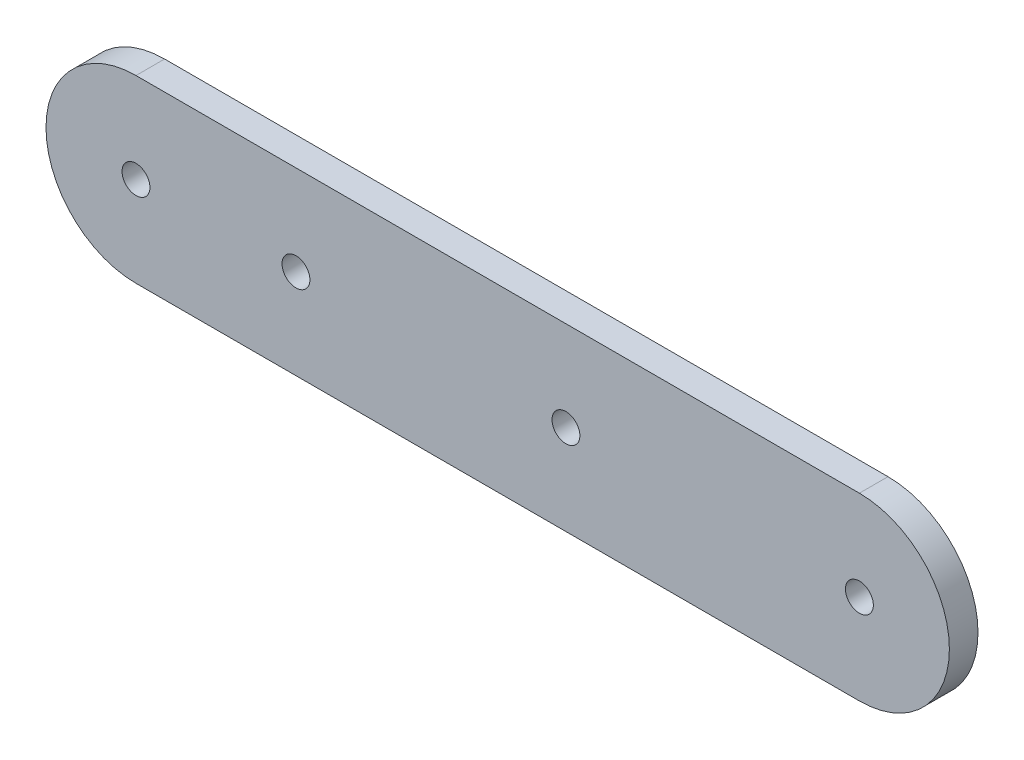
from build123d import *

# Parameters (mm, degrees)
BOSS_EXTRUDE1_DEPTH = 1.59
SKETCH6_R           = 1.55
CUT_EXTRUDE3_DEPTH  = 48.669302491
LPATTERN3_COUNT     = 3
LPATTERN3_PITCH     = 30
BOSS_EXTRUDE2_DEPTH = 1.59
SKETCH11_R          = 1.55
CUT_EXTRUDE7_DEPTH  = 57.396830198


with BuildPart() as part:
    # Sketch1 → Boss-Extrude1 (new, symmetric)
    with BuildSketch(Plane.XY):
        with BuildLine():
            Line((-34.977997181, 10), (45.412002819, 10))
            ThreePointArc((45.412002819, 10), (46.5, 0), (45.412002819, -10))
            Line((45.412002819, -10), (-34.977997181, -10))
            ThreePointArc((-34.977997181, -10), (-44.977997181, 0), (-34.977997181, 10))
        make_face()
    extrude(amount=BOSS_EXTRUDE1_DEPTH, both=True)

    # Sketch6 → Cut-Extrude3 (cut, symmetric)
    with BuildSketch(Plane(origin=(0, 0, -1.59), x_dir=(-1, 0, 0), z_dir=(0, 0, -1))):
        with Locations((-12.8, 0)):
            Circle(SKETCH6_R)
    cut_extrude3 = extrude(amount=CUT_EXTRUDE3_DEPTH, both=True, mode=Mode.SUBTRACT)

    # LPattern3: Cut-Extrude3 ×3
    with Locations(*[(-i * LPATTERN3_PITCH, 0, 0) for i in range(1, LPATTERN3_COUNT)]):
        add(cut_extrude3, mode=Mode.SUBTRACT)

    # Sketch22 → Boss-Extrude2 (add, symmetric)
    with BuildSketch(Plane.XY):
        with BuildLine():
            ThreePointArc((45.412002819, -10), (55.412002819, 0), (45.412002819, 10))
            ThreePointArc((45.412002819, 10), (46.5, 0), (45.412002819, -10))
        make_face()
    extrude(amount=BOSS_EXTRUDE2_DEPTH, both=True)

    # Sketch11 → Cut-Extrude7 (cut, through all)
    with BuildSketch(Plane.XY.offset(1.59)):
        with Locations((-34.977997181, 0)):
            Circle(SKETCH11_R)
        with Locations((45.412002819, 0)):
            Circle(SKETCH11_R)
    extrude(amount=-CUT_EXTRUDE7_DEPTH, mode=Mode.SUBTRACT)


solid = part.part
